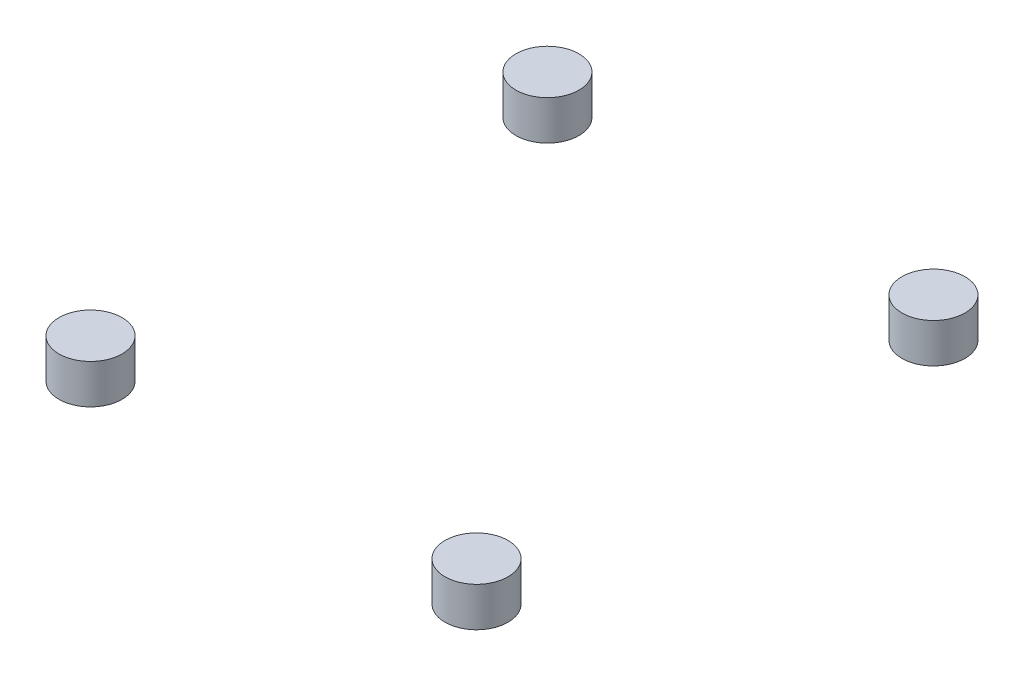
from build123d import *

# Parameters (mm, degrees)
SKETCH1_R             = 4
BOSS_EXTRUDE1_DEPTH   = 5
BOSS_EXTRUDE1_2_DEPTH = 5
BOSS_EXTRUDE1_3_DEPTH = 5
BOSS_EXTRUDE1_4_DEPTH = 5


with BuildPart() as part:
    # Sketch1 → Boss-Extrude1 (new body)
    with BuildSketch(Plane(origin=(0, 0, 0), x_dir=(1, 0, 0), z_dir=(0, 1, 0))):
        with Locations((-24.5, 29)):
            Circle(SKETCH1_R)
    extrude(amount=BOSS_EXTRUDE1_DEPTH)


with BuildPart() as body_2:
    # Sketch1 → Boss-Extrude1 2 (new body)
    with BuildSketch(Plane(origin=(0, 0, 0), x_dir=(1, 0, 0), z_dir=(0, 1, 0))):
        with Locations((24.5, 29)):
            Circle(SKETCH1_R)
    extrude(amount=BOSS_EXTRUDE1_2_DEPTH)


with BuildPart() as body_3:
    # Sketch1 → Boss-Extrude1 3 (new body)
    with BuildSketch(Plane(origin=(0, 0, 0), x_dir=(1, 0, 0), z_dir=(0, 1, 0))):
        with Locations((24.5, -29)):
            Circle(SKETCH1_R)
    extrude(amount=BOSS_EXTRUDE1_3_DEPTH)


with BuildPart() as body_4:
    # Sketch1 → Boss-Extrude1 4 (new body)
    with BuildSketch(Plane(origin=(0, 0, 0), x_dir=(1, 0, 0), z_dir=(0, 1, 0))):
        with Locations((-24.5, -29)):
            Circle(SKETCH1_R)
    extrude(amount=BOSS_EXTRUDE1_4_DEPTH)


solid = Compound([part.part, body_2.part, body_3.part, body_4.part])
